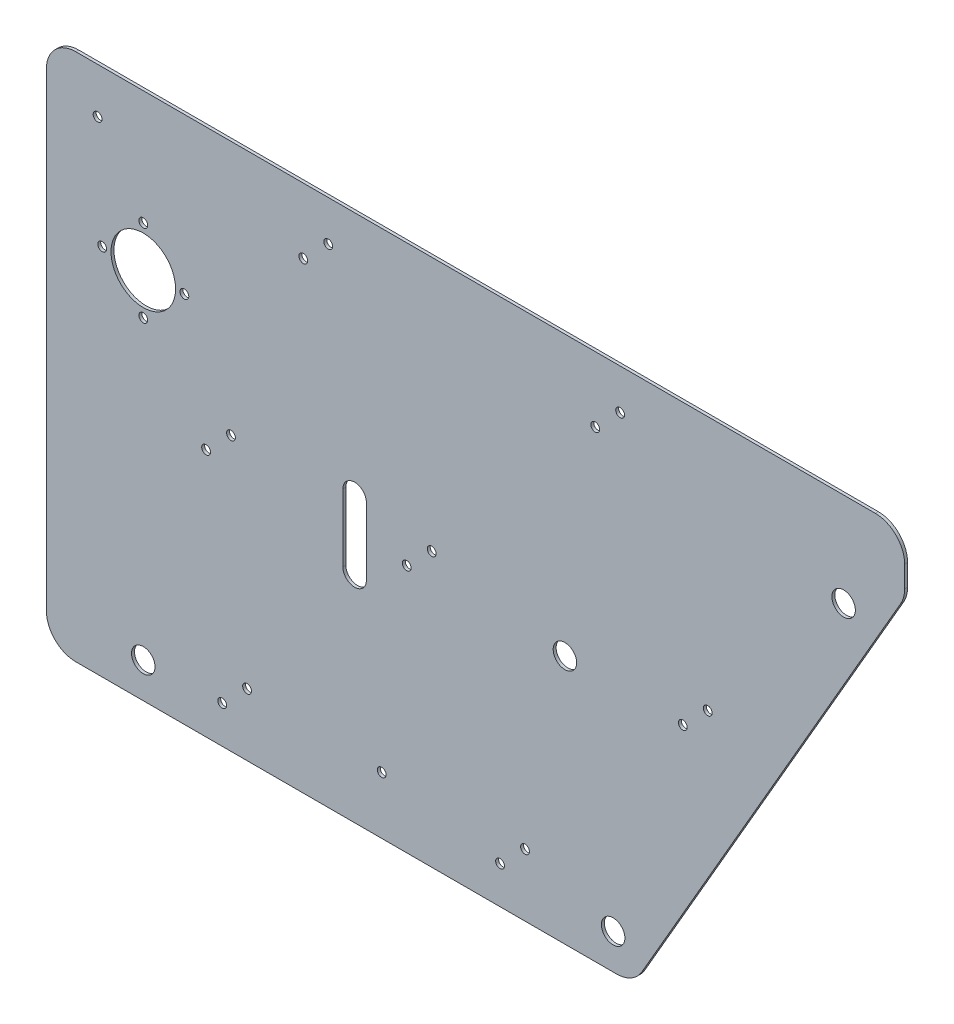
from build123d import *

# Parameters (mm, degrees)
BOSS_EXTRUDE1_DEPTH = 1
FILLET1_R           = 10
SKETCH2_R           = 4
SKETCH2_R_2         = 11
SKETCH2_R_3         = 1.5
CUT_EXTRUDE1_DEPTH  = 3


with BuildPart() as part:
    # Sketch1 → Boss-Extrude1 (new body)
    with BuildSketch(Plane.XY):
        Polygon((-100, 100), (-100, -80), (100, -80), (192.37604307, 80), (192.37604307, 100), align=None)
    extrude(amount=BOSS_EXTRUDE1_DEPTH)

    # Fillet1
    fillet1_edges = [part.edges().sort_by_distance(p)[0] for p in [
        (100, -80, 0.5),
        (-100, -80, 0.5),
        (192.37604307, 100, 0.5),
        (192.37604307, 80, 0.5),
        (-100, 100, 0.5),
    ]]
    fillet(fillet1_edges, radius=FILLET1_R)

    # Sketch2 → Cut-Extrude1 (cut)
    with BuildSketch(Plane.XY.offset(1)):
        with Locations((93.07179677, -68)):
            Circle(SKETCH2_R)
        with Locations((171.59143338, 68)):
            Circle(SKETCH2_R)
        with Locations((-67, 47)):
            Circle(SKETCH2_R_2)
        with Locations((-67, -68)):
            Circle(SKETCH2_R)
        with Locations((-53, 47)):
            Circle(SKETCH2_R_3)
        with Locations((-67, 61)):
            Circle(SKETCH2_R_3)
        with Locations((-81, 47)):
            Circle(SKETCH2_R_3)
        with Locations((-67, 33)):
            Circle(SKETCH2_R_3)
        with Locations((76.640498061, 5)):
            Circle(SKETCH2_R)
        with Locations((54.54952947, -67.242640687)):
            Circle(SKETCH2_R_3)
        with Locations((63.034810844, -58.757359313)):
            Circle(SKETCH2_R_3)
        with Locations((14.225855729, -60.5)):
            Circle(SKETCH2_R_3)
        with Locations((-40.127135228, -67.242640687)):
            Circle(SKETCH2_R_3)
        with Locations((-31.641853854, -58.757359313)):
            Circle(SKETCH2_R_3)
        with Locations((-82.576317869, 84.5)):
            Circle(SKETCH2_R_3)
        with Locations((-12.482801161, 77.757359313)):
            Circle(SKETCH2_R_3)
        with Locations((-3.997519787, 86.242640687)):
            Circle(SKETCH2_R_3)
        with Locations((86.965374539, 77.757359313)):
            Circle(SKETCH2_R_3)
        with Locations((95.450655913, 86.242640687)):
            Circle(SKETCH2_R_3)
        with Locations((22.762645068, 4.757359313)):
            Circle(SKETCH2_R_3)
        with Locations((31.247926442, 13.242640687)):
            Circle(SKETCH2_R_3)
        with Locations((-45.601368119, 4.757359313)):
            Circle(SKETCH2_R_3)
        with Locations((-37.116086745, 13.242640687)):
            Circle(SKETCH2_R_3)
        with Locations((116.811272287, 4.757359313)):
            Circle(SKETCH2_R_3)
        with Locations((125.296553661, 13.242640687)):
            Circle(SKETCH2_R_3)
        with BuildLine():
            Line((1, -6.5), (1, 16.5))
            ThreePointArc((1, 16.5), (5, 20.5), (9, 16.5))
            Line((9, 16.5), (9, -6.5))
            ThreePointArc((9, -6.5), (5, -10.5), (1, -6.5))
        make_face()
    extrude(amount=-CUT_EXTRUDE1_DEPTH, mode=Mode.SUBTRACT)


solid = part.part
